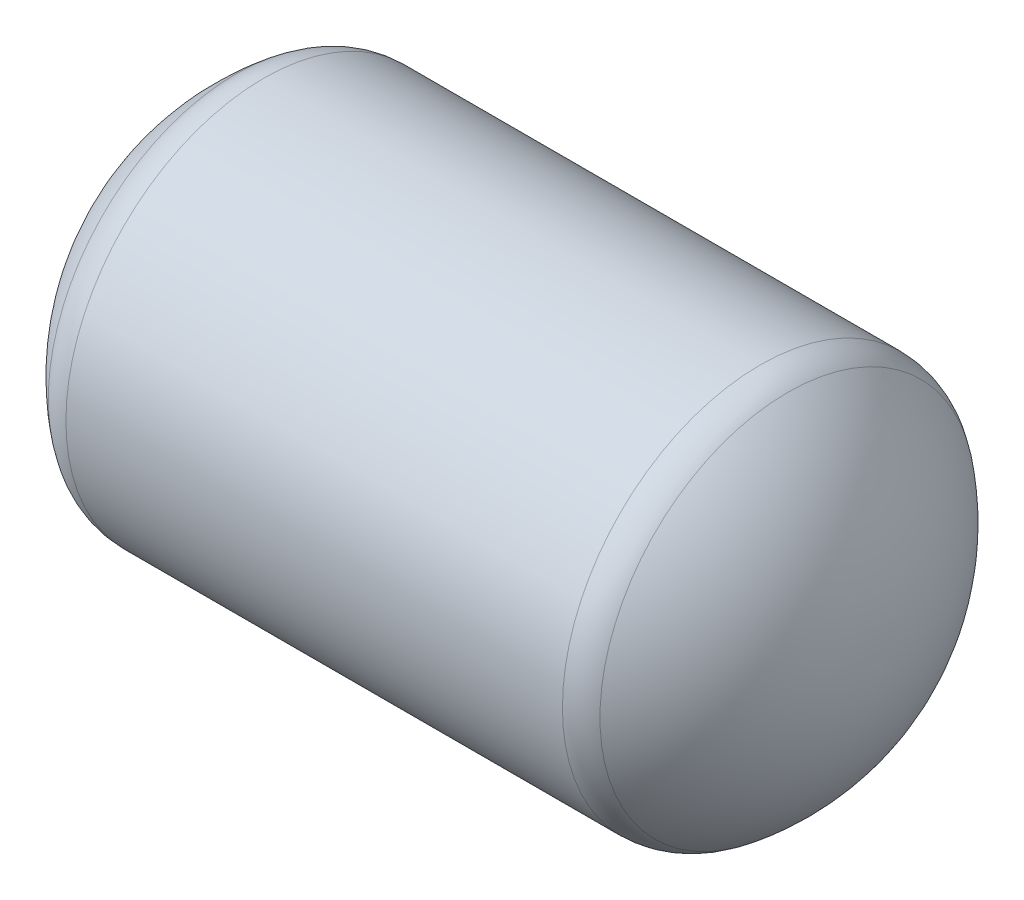
from build123d import *

# Parameters (mm, degrees)
SKETCH1_R           = 510
SKETCH1_R_2         = 500
EXTRUDE_THIN1_DEPTH = 640


# Read off the part's stored shape, not the designer's step: Shell2
with BuildPart() as part:
    # Sketch1 → Extrude-Thin1 (new body)
    with BuildSketch(Plane(origin=(0, 0, 0), x_dir=(0, 0, -1), z_dir=(1, 0, 0))):
        Circle(SKETCH1_R)
        Circle(SKETCH1_R_2, mode=Mode.SUBTRACT)
    extrude(amount=-EXTRUDE_THIN1_DEPTH)

    # Sketch3 → Revolve2 (revolve)
    with BuildSketch(Plane.XY):
        with BuildLine():
            Line((0, 510), (0, 0))
            Line((0, 0), (300, 0))
            ThreePointArc((300, 0), (242.622214626, 269.135210935), (71.132598541, 484.349716939))
            ThreePointArc((71.132598541, 484.349716939), (37.639481394, 502.924145188), (0, 510))
        make_face()
    revolve(axis=Axis((300, 0, 0), (-1, 0, 0)))

    # Shell2 outline → Shell2 (revolve, cut)
    with BuildSketch(Plane.YX):
        with BuildLine():
            Line((0, 289.997686127), (0, 0))
            Line((0, 0), (499.996435901, 0))
            ThreePointArc((499.996435901, 0), (493.473636432, 34.367523582), (476.490506402, 64.94933001))
            add(Edge.make_bspline(
                [(476.490506402, 64.94933001), (412.902143842, 145.7729796), (327.84150565, 217.505175066), (225.442664467, 267.412978855), (116.150802911, 290.136485148), (10.231131827, 290.136486709), (7.668298767, 290.122537258), (5.108738263, 290.094706349), (2.552592151, 290.053064812), (0, 289.997686127)],
                knots=[0.666612016, 0.666612016, 0.666612016, 0.666612016, 0.666612016, 0.666612016, 1.570058153, 1.570058153, 1.570058153, 1.570058153, 1.592488002, 1.592488002, 1.592488002, 1.592488002, 1.592488002, 1.592488002], degree=5, weights=[1, 1, 0.995984064, 0.995943782, 1, 1, 0.999999999, 0.999999999, 1, 1]))
        make_face()
    revolve(axis=Axis((0, 0, 0), (1, 0, 0)), mode=Mode.SUBTRACT)

    # Mirror4: part across plane


with BuildPart() as part_1:
    add(part.part)
    add(part.part.mirror(Plane.ZY.offset(640)))


solid = part_1.part
